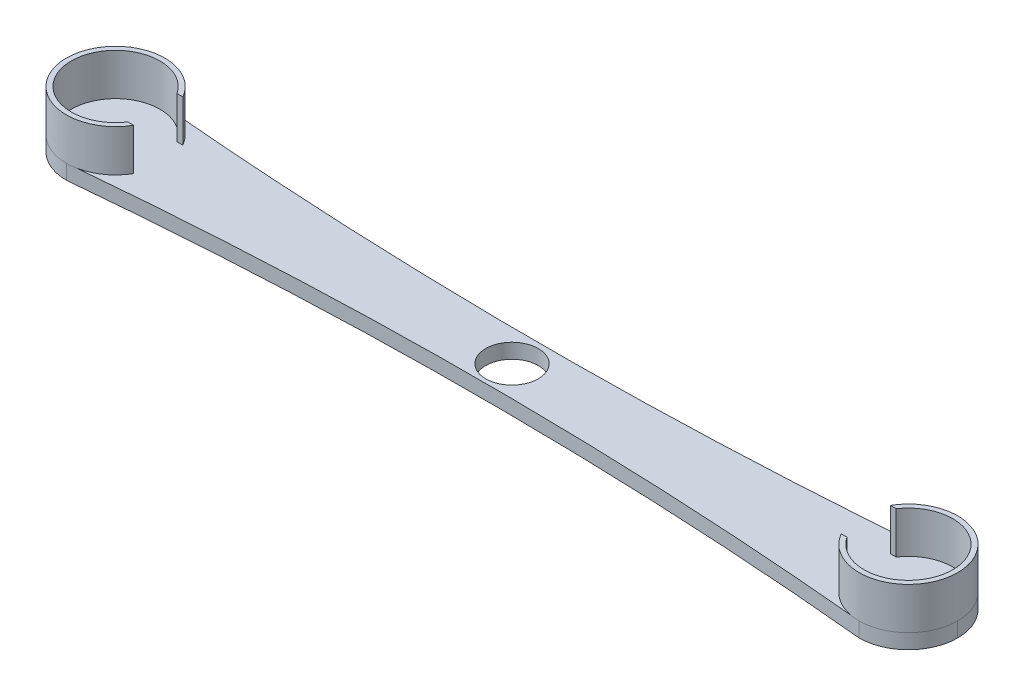
from build123d import *

# Parameters (mm, degrees)
SKETCH1_R           = 5.334493613
BOSS_EXTRUDE1_DEPTH = 3
BOSS_EXTRUDE3_DEPTH = 8.5
FILLET1_R           = 10


with BuildPart() as part:
    # Sketch1 → Boss-Extrude1 (new body)
    with BuildSketch(Plane(origin=(0, 0, 0), x_dir=(1, 0, 0), z_dir=(0, 1, 0))):
        with BuildLine():
            Line((-90.5, -10), (-90.5, 10))
            Line((-90.5, 10), (-80.5, 10))
            add(Edge.make_bspline(
                [(-80.5, 10), (0, 2.75), (80.5, 10)],
                knots=[0, 0, 0, 1, 1, 1], degree=2))
            Line((80.5, 10), (90.5, 10))
            Line((90.5, 10), (90.5, -10))
            Line((90.5, -10), (80.5, -10))
            add(Edge.make_bspline(
                [(-80.5, -10), (0, -2.264995309), (80.5, -10)],
                knots=[0, 0, 0, 1, 1, 1], degree=2))
            Line((-80.5, -10), (-90.5, -10))
        make_face()
        with Locations(Location((0, 0, 0), (0, 0, 270))):
            Circle(SKETCH1_R, mode=Mode.SUBTRACT)
    extrude(amount=BOSS_EXTRUDE1_DEPTH)

    # Sketch3 → Boss-Extrude3 (add)
    with BuildSketch(Plane(origin=(0, 3, 0), x_dir=(1, 0, 0), z_dir=(0, 1, 0))):
        with BuildLine():
            Line((71.839745962, 5), (73.016685226, 5))
            ThreePointArc((73.016685226, 5), (89.5, 0), (73.016685226, -5))
            Line((73.016685226, -5), (71.839745962, -5))
            ThreePointArc((71.839745962, -5), (90.5, 0), (71.839745962, 5))
        make_face()
        with BuildLine():
            Line((-73.016685226, -5), (-71.839745962, -5))
            ThreePointArc((-71.839745962, -5), (-90.5, 0), (-71.839745962, 5))
            Line((-71.839745962, 5), (-73.016685226, 5))
            ThreePointArc((-73.016685226, 5), (-89.5, 0), (-73.016685226, -5))
        make_face()
    extrude(amount=BOSS_EXTRUDE3_DEPTH)

    # Fillet1
    fillet1_edges = [part.edges().sort_by_distance(p)[0] for p in [
        (-90.5, 1.5, 10),
        (-90.5, 1.5, -10),
        (90.5, 1.5, -10),
        (90.5, 1.5, 10),
    ]]
    fillet(fillet1_edges, radius=FILLET1_R - 0.0001)  # a hair under: the kernel refuses the full size


solid = part.part
